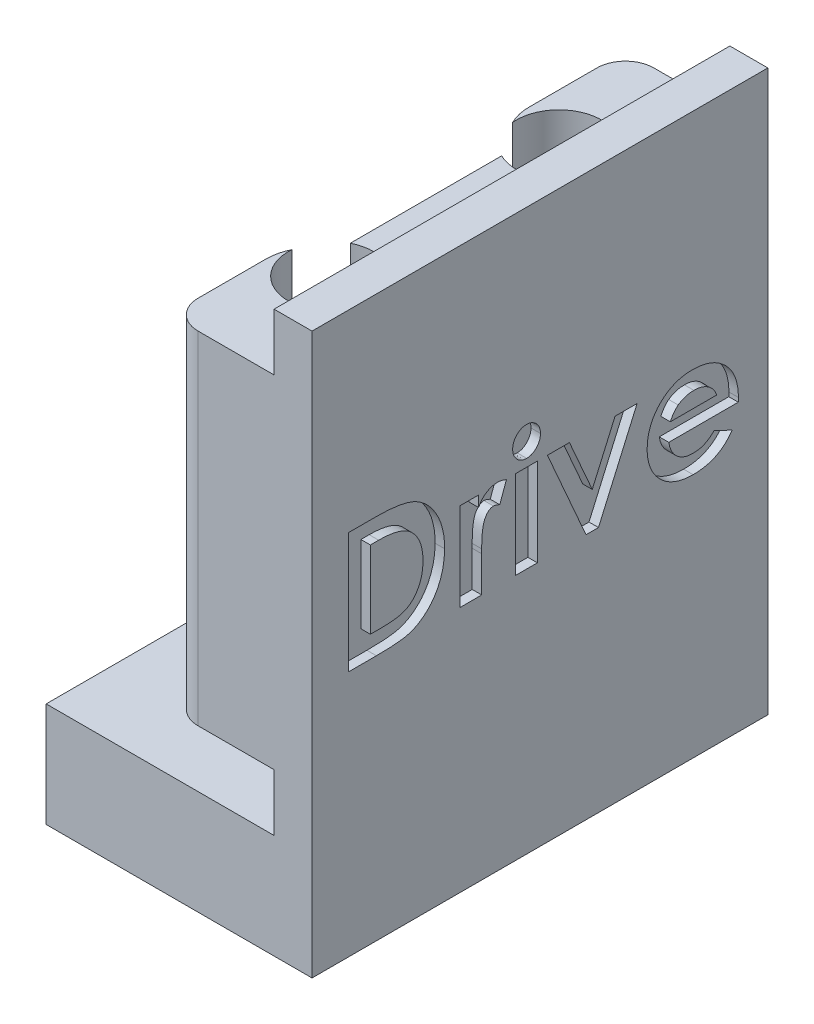
from build123d import *

# Parameters (mm, degrees)
SKETCH1_W           = 12
SKETCH1_H           = 24
BOSS_EXTRUDE1_DEPTH = 5.5
SKETCH2_W           = 2
SKETCH2_H           = 24
BOSS_EXTRUDE2_DEPTH = 29.5
BOSS_EXTRUDE4_START = 3
SKETCH4_W           = 5.5
SKETCH4_H           = 24
BOSS_EXTRUDE4_DEPTH = 18
SKETCH5_W           = 9.25
SKETCH5_H           = 18
CUT_EXTRUDE1_DEPTH  = 1.5
FILLET1_R           = 2.5
SKETCH6_R           = 2.25
CUT_EXTRUDE2_DEPTH  = 31.170349683
FILLET2_R           = 1.5
SKETCH7_W           = 1.13974359
SKETCH7_H           = 4.640384615
CUT_EXTRUDE3_DEPTH  = 0.5


with BuildPart() as part:
    # Sketch1 → Boss-Extrude1 (new body)
    with BuildSketch(Plane(origin=(0, 0, 0), x_dir=(1, 0, 0), z_dir=(0, 1, 0))):
        Rectangle(SKETCH1_W, SKETCH1_H)
    extrude(amount=BOSS_EXTRUDE1_DEPTH)

    # Sketch2 → Boss-Extrude2 (add)
    with BuildSketch(Plane(origin=(0, 0, 0), x_dir=(1, 0, 0), z_dir=(0, 1, 0))):
        with Locations((7, 0)):
            Rectangle(SKETCH2_W, SKETCH2_H)
    extrude(amount=BOSS_EXTRUDE2_DEPTH)

    # Sketch4 → Boss-Extrude4 (add)
    with BuildSketch(Plane(origin=(0, 5.5, 0), x_dir=(1, 0, 0), z_dir=(0, 1, 0)).offset(BOSS_EXTRUDE4_START)):
        with Locations((3.25, 0)):
            Rectangle(SKETCH4_W, SKETCH4_H)
    extrude(amount=BOSS_EXTRUDE4_DEPTH)

    # Sketch5 → Cut-Extrude1 (cut)
    with BuildSketch(Plane.ZY.offset(-0.5)):
        with Locations((0, 17.5)):
            Rectangle(SKETCH5_W, SKETCH5_H)
    extrude(amount=-CUT_EXTRUDE1_DEPTH, mode=Mode.SUBTRACT)

    # Fillet1
    # the kernel refuses this fillet: 2.5 mm, written as the material it takes off along each edge
    with BuildSketch(Plane(origin=(0.5, 32.228219619, 4.625), x_dir=(0, 0, 1), z_dir=(0, -1, 0)), Plane(origin=(0.5, 8.5, -4.625), x_dir=(0, 0, -1), z_dir=(0, 1, 0))) as fillet1_piece_1:
        with BuildLine():
            CenterArc((2.291287847, -2.5), FILLET1_R, 90, 66.421821522)
            Line((0, -1.5), (0, 0))
            Line((0, 0), (2.291287847, 0))
        make_face()
    extrude(amount=23.728219619, mode=Mode.SUBTRACT)

    # Sketch6 → Cut-Extrude2 (cut, through all)
    with BuildSketch(Plane(origin=(0, 26.5, 0), x_dir=(1, 0, 0), z_dir=(0, 1, 0))):
        with Locations(Location((3, -6, 0), (0, 0, 270))):
            Circle(SKETCH6_R)
        with Locations(Location((3, 6, 0), (0, 0, 270))):
            Circle(SKETCH6_R)
    extrude(amount=-CUT_EXTRUDE2_DEPTH, mode=Mode.SUBTRACT)

    # Fillet2
    fillet2_edges = [part.edges().sort_by_distance(p)[0] for p in [
        (0.5, 17.5, -12),
        (0.5, 17.5, 12),
    ]]
    fillet(fillet2_edges, radius=FILLET2_R)

    # Sketch7 → Cut-Extrude3 (cut)
    # profile 1 of 6: a face of its own
    with BuildSketch(Plane(origin=(8, 0, 0), x_dir=(0, 0, -1), z_dir=(1, 0, 0))):
        with BuildLine():
            Line((-10.067307692, 19.35), (-8.631179888, 19.35))
            add(Edge.make_bspline(
                [(-8.631179888, 19.35), (-8.519217207, 19.349217343), (-8.302792079, 19.347704457), (-7.989234885, 19.330657873), (-7.697666596, 19.304441438), (-7.42789926, 19.268375979), (-7.180485945, 19.220651502), (-6.955745684, 19.160790499), (-6.752924197, 19.091690929), (-6.569797586, 19.010381264), (-6.402620604, 18.915582269), (-6.243880724, 18.8099838), (-6.093889629, 18.689717475), (-5.950542429, 18.557103473), (-5.815689052, 18.40971566), (-5.687083706, 18.249995313), (-5.567875232, 18.075626266), (-5.454460217, 17.890789339), (-5.351891428, 17.694701211), (-5.262427097, 17.489030944), (-5.187482285, 17.275102101), (-5.126585744, 17.052686691), (-5.078044173, 16.822523065), (-5.044080614, 16.584146775), (-5.023084003, 16.337778516), (-5.020954072, 16.17080265), (-5.019871795, 16.085957532)],
                knots=[0, 0, 0, 0, 1.44355588, 2.790409838, 4.047694926, 5.217575253, 6.298404546, 7.294384826, 8.214239204, 9.058592145, 9.873746385, 10.689560431, 11.514393297, 12.350027578, 13.205127629, 14.088021785, 14.991911688, 15.926770944, 16.882954281, 17.842803888, 18.816321264, 19.80318086, 20.814351908, 21.847355356, 22.906180909, 24, 24, 24, 24], degree=3))
            add(Edge.make_bspline(
                [(-5.019871795, 16.085957532), (-5.022705781, 15.966235547), (-5.02828465, 15.730555813), (-5.075277922, 15.384698517), (-5.151281955, 15.053159804), (-5.258150529, 14.738533098), (-5.390638952, 14.443620195), (-5.548911209, 14.173621763), (-5.730646661, 13.929987014), (-5.933728078, 13.713929051), (-6.153615793, 13.528224304), (-6.382123469, 13.369181777), (-6.621477188, 13.243763475), (-6.832381264, 13.164229515), (-7.015261411, 13.114766274), (-7.175828201, 13.085533022), (-7.358215691, 13.058724366), (-7.564124486, 13.038007214), (-7.79265131, 13.019532606), (-8.044707072, 13.009494223), (-8.319475689, 13.001153816), (-8.510328472, 13.000394683), (-8.609555288, 13)],
                knots=[0, 0, 0, 0, 1.315458931, 2.589557908, 3.828601765, 5.048913369, 6.235739168, 7.376350998, 8.481830359, 9.569842114, 10.627874879, 11.640079404, 12.624025415, 13.590060155, 14.111227486, 14.704434459, 15.382649715, 16.137166398, 16.978595427, 17.902333227, 18.909396075, 20, 20, 20, 20], degree=3))
            Line((-8.609555288, 13), (-10.067307692, 13))
            Line((-10.067307692, 13), (-10.067307692, 19.35))
        make_face()
        with BuildLine():
            Line((-8.927564103, 18.21025641), (-8.927564103, 14.13974359))
            Line((-8.927564103, 14.13974359), (-8.332251603, 14.13974359))
            add(Edge.make_bspline(
                [(-8.332251603, 14.13974359), (-8.261418558, 14.139873385), (-8.125183032, 14.140123025), (-7.928489771, 14.152013588), (-7.746598378, 14.163948435), (-7.580009556, 14.186601173), (-7.427510926, 14.211834729), (-7.291197417, 14.246950677), (-7.168259017, 14.283837006), (-7.060197395, 14.330797874), (-6.961221754, 14.383655457), (-6.869581615, 14.445584243), (-6.781123224, 14.514353825), (-6.697500382, 14.591986813), (-6.618396595, 14.677455201), (-6.544279894, 14.771199369), (-6.474161014, 14.872933302), (-6.409839776, 14.983194891), (-6.351062684, 15.100819751), (-6.298920818, 15.224668511), (-6.255687516, 15.355772567), (-6.219754643, 15.492904625), (-6.19407653, 15.637258577), (-6.17283279, 15.787765213), (-6.161881023, 15.945020826), (-6.160377961, 16.052022802), (-6.159615385, 16.106310096)],
                knots=[0, 0, 0, 0, 1.50275155, 2.890291501, 4.180787663, 5.369391935, 6.45668281, 7.458360028, 8.354766181, 9.177074746, 9.954075863, 10.732690366, 11.5210699, 12.329727389, 13.151100085, 13.990027547, 14.863562427, 15.770965086, 16.696477834, 17.652329173, 18.619756807, 19.62365428, 20.657822005, 21.729286259, 22.847956731, 24, 24, 24, 24], degree=3))
            add(Edge.make_bspline(
                [(-6.159615385, 16.106310096), (-6.161134177, 16.189500243), (-6.164095706, 16.351714583), (-6.192656045, 16.58798331), (-6.239146828, 16.810465712), (-6.305484697, 17.018336095), (-6.389105637, 17.212178686), (-6.493776736, 17.390351227), (-6.614993352, 17.55584677), (-6.710848146, 17.652931767), (-6.75874399, 17.701442308)],
                knots=[0, 0, 0, 0, 1.13821349, 2.219428113, 3.251817212, 4.244760574, 5.201143372, 6.134805572, 7.068016741, 8, 8, 8, 8], degree=3))
            add(Edge.make_bspline(
                [(-6.75874399, 17.701442308), (-6.805973828, 17.742779847), (-6.902435424, 17.82720709), (-7.071790288, 17.928372517), (-7.258410577, 18.017256262), (-7.466565604, 18.087731158), (-7.694243643, 18.143465711), (-7.942800748, 18.181904469), (-8.210905843, 18.206604808), (-8.396642806, 18.209013132), (-8.492528045, 18.21025641)],
                knots=[0, 0, 0, 0, 0.813307809, 1.661089106, 2.549956539, 3.493439533, 4.508053171, 5.589449661, 6.755572447, 8, 8, 8, 8], degree=3))
            Line((-8.492528045, 18.21025641), (-8.927564103, 18.21025641))
        make_face(mode=Mode.SUBTRACT)
    # profile 2 of 6: a face of its own
    with BuildSketch(Plane(origin=(8, 0, 0), x_dir=(0, 0, -1), z_dir=(1, 0, 0))):
        with BuildLine():
            Line((-4.205769231, 17.640384615), (-3.228846154, 17.640384615))
            Line((-3.228846154, 17.640384615), (-3.228846154, 17.069240785))
            add(Edge.make_bspline(
                [(-3.228846154, 17.069240785), (-3.201210875, 17.119998495), (-3.147196577, 17.219206543), (-3.047967782, 17.352373702), (-2.933969722, 17.464523368), (-2.809298701, 17.558001253), (-2.673576866, 17.630858085), (-2.530438606, 17.682777764), (-2.381108465, 17.71651836), (-2.279240505, 17.72002337), (-2.227754407, 17.721794872)],
                knots=[0, 0, 0, 0, 1.09866127, 2.147379032, 3.14564304, 4.131443017, 5.102343063, 6.064490016, 7.021754664, 8, 8, 8, 8], degree=3))
            add(Edge.make_bspline(
                [(-2.227754407, 17.721794872), (-2.190369076, 17.720044258), (-2.114239191, 17.716479383), (-1.998206534, 17.695756709), (-1.88049973, 17.658286175), (-1.80303851, 17.624548939), (-1.763461538, 17.607311699)],
                knots=[0, 0, 0, 0, 0.931404136, 1.896671404, 2.925354185, 4, 4, 4, 4], degree=3))
            Line((-1.763461538, 17.607311699), (-2.11708734, 16.641836939))
            add(Edge.make_bspline(
                [(-2.11708734, 16.641836939), (-2.148696437, 16.657108926), (-2.208109371, 16.685814384), (-2.294366635, 16.71968978), (-2.372648679, 16.740358892), (-2.422278057, 16.743442904), (-2.445272436, 16.744871795)],
                knots=[0, 0, 0, 0, 1.214386998, 2.282580073, 3.20428172, 4, 4, 4, 4], degree=3))
            add(Edge.make_bspline(
                [(-2.445272436, 16.744871795), (-2.466983601, 16.743924936), (-2.509693203, 16.742062303), (-2.572731382, 16.726100166), (-2.632100218, 16.698573954), (-2.690660695, 16.663310146), (-2.743793039, 16.614290815), (-2.796892564, 16.557542236), (-2.843686709, 16.487478566), (-2.893068103, 16.409494144), (-2.935114594, 16.314041281), (-2.971168165, 16.200090234), (-3.003292187, 16.06632251), (-3.025397899, 15.912027868), (-3.046763958, 15.738699375), (-3.059481561, 15.545064821), (-3.068960152, 15.331736498), (-3.069539704, 15.18282563), (-3.069841747, 15.105218349)],
                knots=[0, 0, 0, 0, 0.544232178, 1.070598461, 1.618251235, 2.182094276, 2.777567932, 3.425210017, 4.127676488, 4.886675562, 5.738955394, 6.734782583, 7.883056018, 9.186093582, 10.642914445, 12.264202625, 14.053029461, 16, 16, 16, 16], degree=3))
            Line((-3.069841747, 15.105218349), (-3.066025641, 14.878796074))
            Line((-3.066025641, 14.878796074), (-3.066025641, 13))
            Line((-3.066025641, 13), (-4.205769231, 13))
            Line((-4.205769231, 13), (-4.205769231, 17.640384615))
        make_face()
    # profile 3 of 6: a face of its own
    with BuildSketch(Plane(origin=(8, 0, 0), x_dir=(0, 0, -1), z_dir=(1, 0, 0))):
        with BuildLine():
            add(Edge.make_bspline(
                [(-0.707672276, 19.594230769), (-0.658549335, 19.591820612), (-0.562091708, 19.587088036), (-0.423903032, 19.540955945), (-0.297073833, 19.468553007), (-0.184953304, 19.36921445), (-0.091701932, 19.250586044), (-0.020454421, 19.117773656), (0.0192346, 18.970621808), (0.024746818, 18.86897085), (0.027564103, 18.817017228)],
                knots=[0, 0, 0, 0, 0.989868614, 1.943702388, 2.910836514, 3.924849579, 4.949916355, 5.946401046, 6.950409252, 8, 8, 8, 8], degree=3))
            add(Edge.make_bspline(
                [(0.027564103, 18.817017228), (0.024847616, 18.765446475), (0.019554411, 18.664958407), (-0.021367888, 18.519804214), (-0.089755772, 18.387056333), (-0.183762421, 18.270189779), (-0.294667417, 18.172451128), (-0.418725301, 18.098733758), (-0.555589729, 18.055167985), (-0.650550625, 18.050039792), (-0.698768029, 18.047435897)],
                knots=[0, 0, 0, 0, 1.05296456, 2.051751585, 3.055639087, 4.085634717, 5.099016424, 6.062201612, 7.016062274, 8, 8, 8, 8], degree=3))
            add(Edge.make_bspline(
                [(-0.698768029, 18.047435897), (-0.748319772, 18.049837439), (-0.845616576, 18.054552961), (-0.984938685, 18.10079299), (-1.113459461, 18.172625708), (-1.225093612, 18.273993905), (-1.31941292, 18.393465256), (-1.387548312, 18.529369631), (-1.430168685, 18.6775277), (-1.435227686, 18.780684178), (-1.437820513, 18.833553686)],
                knots=[0, 0, 0, 0, 0.989065327, 1.942068821, 2.907541208, 3.917690034, 4.939857478, 5.938239964, 6.943311734, 8, 8, 8, 8], degree=3))
            add(Edge.make_bspline(
                [(-1.437820513, 18.833553686), (-1.434998808, 18.884248737), (-1.429455977, 18.983831845), (-1.389529215, 19.127712077), (-1.319915407, 19.25829168), (-1.227335734, 19.374748483), (-1.1162, 19.472234002), (-0.989446939, 19.542438015), (-0.852188277, 19.586664719), (-0.756341675, 19.591682712), (-0.707672276, 19.594230769)],
                knots=[0, 0, 0, 0, 1.038616768, 2.040212704, 3.031499824, 4.052181184, 5.074969369, 6.039807101, 7.004644834, 8, 8, 8, 8], degree=3))
        make_face()
    # profile 4 of 6: a face of its own
    with BuildSketch(Plane(origin=(8, 0, 0), x_dir=(0, 0, -1), z_dir=(1, 0, 0))):
        with Locations((-0.705128205, 15.320192308)):
            Rectangle(SKETCH7_W, SKETCH7_H)
    # profile 5 of 6: a face of its own
    with BuildSketch(Plane(origin=(8, 0, 0), x_dir=(0, 0, -1), z_dir=(1, 0, 0))):
        Polygon((0.393910256, 17.640384615), (1.55400641, 17.640384615), (2.754807692, 14.901692708), (3.955608974, 17.640384615), (5.115705128, 17.640384615), (3.082992788, 13), (2.426622596, 13), align=None)
    # profile 6 of 6: a face of its own
    with BuildSketch(Plane(origin=(8, 0, 0), x_dir=(0, 0, -1), z_dir=(1, 0, 0))):
        with BuildLine():
            Line((10.444260817, 15.03525641), (6.784615385, 15.03525641))
            add(Edge.make_bspline(
                [(6.784615385, 15.03525641), (6.792077106, 14.992733407), (6.806739978, 14.909172349), (6.838580924, 14.787792663), (6.879214748, 14.673406495), (6.927911826, 14.56586094), (6.983851127, 14.464587446), (7.049099688, 14.370061025), (7.122829889, 14.28236517), (7.204615442, 14.201881016), (7.293093131, 14.12976547), (7.387833872, 14.066587692), (7.48893543, 14.01478578), (7.595238715, 13.971122143), (7.707538057, 13.936536119), (7.825998732, 13.912682796), (7.95030672, 13.89859255), (8.034989118, 13.896554558), (8.07827524, 13.895512821)],
                knots=[0, 0, 0, 0, 1.091296461, 2.144483647, 3.168565212, 4.157007626, 5.126487748, 6.090021542, 7.05641414, 8.019231907, 8.98705074, 9.938580405, 10.892824166, 11.854447369, 12.841318655, 13.858982407, 14.905600794, 16, 16, 16, 16], degree=3))
            add(Edge.make_bspline(
                [(8.07827524, 13.895512821), (8.130524529, 13.896892252), (8.233418764, 13.89960876), (8.384159585, 13.923700144), (8.529947917, 13.960089121), (8.669404089, 14.014202584), (8.804143481, 14.081564334), (8.93194787, 14.165488785), (9.055029449, 14.263523391), (9.130123716, 14.339088428), (9.168409455, 14.377614183)],
                knots=[0, 0, 0, 0, 1.021034703, 2.010718019, 2.977989445, 3.954245119, 4.929443971, 5.918328161, 6.938689359, 8, 8, 8, 8], degree=3))
            Line((9.168409455, 14.377614183), (10.122435897, 13.923497596))
            add(Edge.make_bspline(
                [(10.122435897, 13.923497596), (10.092398932, 13.881991119), (10.032881789, 13.799747562), (9.93572205, 13.684009637), (9.834329676, 13.576021456), (9.728629048, 13.476493277), (9.618486112, 13.385708714), (9.504207259, 13.302561847), (9.384122349, 13.229285137), (9.260632459, 13.1623335), (9.131184825, 13.104936172), (8.996137684, 13.055989757), (8.856063038, 13.011742614), (8.709192047, 12.978028715), (8.556747703, 12.951341068), (8.398365331, 12.932389303), (8.234065804, 12.920683706), (8.122392372, 12.919296022), (8.065554888, 12.918589744)],
                knots=[0, 0, 0, 0, 1.028154879, 2.037251081, 3.030720504, 4.000128189, 4.949298328, 5.894184978, 6.834267904, 7.770992897, 8.712077017, 9.673380525, 10.653304757, 11.658697181, 12.695551717, 13.758623199, 14.859225354, 16, 16, 16, 16], degree=3))
            add(Edge.make_bspline(
                [(8.065554888, 12.918589744), (7.978111351, 12.920372454), (7.806858225, 12.92386379), (7.556369569, 12.956268385), (7.318474822, 13.009998697), (7.092502251, 13.083036803), (6.879428661, 13.179469984), (6.679148601, 13.297415765), (6.489660987, 13.434612887), (6.316755722, 13.593940755), (6.159233925, 13.767359666), (6.020876573, 13.953599735), (5.905101111, 14.151359771), (5.810023973, 14.359330959), (5.736126718, 14.578045623), (5.682851084, 14.807599205), (5.650192482, 15.047882066), (5.646665191, 15.211541517), (5.644871795, 15.294751603)],
                knots=[0, 0, 0, 0, 1.103565453, 2.161269334, 3.182010356, 4.179077853, 5.15417608, 6.128274628, 7.109042802, 8.101804412, 9.090965879, 10.063106201, 11.02526161, 11.978650795, 12.945248442, 13.93468508, 14.949922959, 16, 16, 16, 16], degree=3))
            add(Edge.make_bspline(
                [(5.644871795, 15.294751603), (5.646682842, 15.380076163), (5.650245995, 15.547948405), (5.682569894, 15.793779508), (5.736274007, 16.028335629), (5.810387427, 16.251939779), (5.904022234, 16.465291295), (6.02127074, 16.666523606), (6.159165266, 16.856337294), (6.316119594, 17.033844392), (6.489757338, 17.194063941), (6.674263846, 17.336851578), (6.871712238, 17.455831714), (7.079869202, 17.551967591), (7.297403291, 17.630075564), (7.526828896, 17.682049897), (7.766400437, 17.71694755), (7.930166266, 17.720161406), (8.013401442, 17.721794872)],
                knots=[0, 0, 0, 0, 1.079208495, 2.12329425, 3.130605359, 4.119693003, 5.099659317, 6.073216462, 7.060498243, 8.06384408, 9.066070512, 10.045757761, 11.010926815, 11.975797609, 12.942977511, 13.929384301, 14.947594487, 16, 16, 16, 16], degree=3))
            add(Edge.make_bspline(
                [(8.013401442, 17.721794872), (8.101263893, 17.719984504), (8.273772759, 17.716430033), (8.526005991, 17.684288555), (8.765480331, 17.630230603), (8.993216073, 17.557824044), (9.206304939, 17.458954859), (9.409429137, 17.343911537), (9.597716597, 17.203748795), (9.773174263, 17.045200627), (9.931560666, 16.869296929), (10.070007931, 16.678211638), (10.187809514, 16.473809633), (10.283288866, 16.255262022), (10.357110242, 16.023224905), (10.410435192, 15.777999628), (10.442844687, 15.518653473), (10.446306343, 15.341064296), (10.448076923, 15.250230369)],
                knots=[0, 0, 0, 0, 1.080001299, 2.120471247, 3.119684163, 4.095710327, 5.052285597, 6.002875087, 6.961153713, 7.931888285, 8.906493152, 9.865905668, 10.82813294, 11.801621613, 12.7925306, 13.817193356, 14.883530496, 16, 16, 16, 16], degree=3))
            Line((10.448076923, 15.250230369), (10.444260817, 15.03525641))
        make_face()
        with BuildLine():
            add(Edge.make_bspline(
                [(9.308333333, 15.930769231), (9.286825675, 15.988809689), (9.244062847, 16.10420924), (9.147463398, 16.263432462), (9.01927902, 16.401326239), (8.870191392, 16.523404693), (8.699849442, 16.622491192), (8.513620943, 16.694233035), (8.313859788, 16.737250345), (8.176434878, 16.742295519), (8.106260016, 16.744871795)],
                knots=[0, 0, 0, 0, 0.954238005, 1.897273737, 2.851915805, 3.847685534, 4.862635127, 5.880135777, 6.917509367, 8, 8, 8, 8], degree=3))
            add(Edge.make_bspline(
                [(8.106260016, 16.744871795), (8.029617642, 16.742396969), (7.879797759, 16.737559198), (7.663692777, 16.686107737), (7.459846356, 16.609317969), (7.339670059, 16.530146086), (7.279437099, 16.490464744)],
                knots=[0, 0, 0, 0, 1.044195649, 2.041185066, 3.018232172, 4, 4, 4, 4], degree=3))
            add(Edge.make_bspline(
                [(7.279437099, 16.490464744), (7.241856231, 16.460242564), (7.16173574, 16.395810421), (7.057683029, 16.267274414), (6.955190241, 16.111646164), (6.896917441, 15.993435514), (6.866025641, 15.930769231)],
                knots=[0, 0, 0, 0, 0.82159062, 1.751589201, 2.808063854, 4, 4, 4, 4], degree=3))
            Line((6.866025641, 15.930769231), (9.308333333, 15.930769231))
        make_face(mode=Mode.SUBTRACT)
    extrude(amount=-CUT_EXTRUDE3_DEPTH, mode=Mode.SUBTRACT)


solid = part.part
